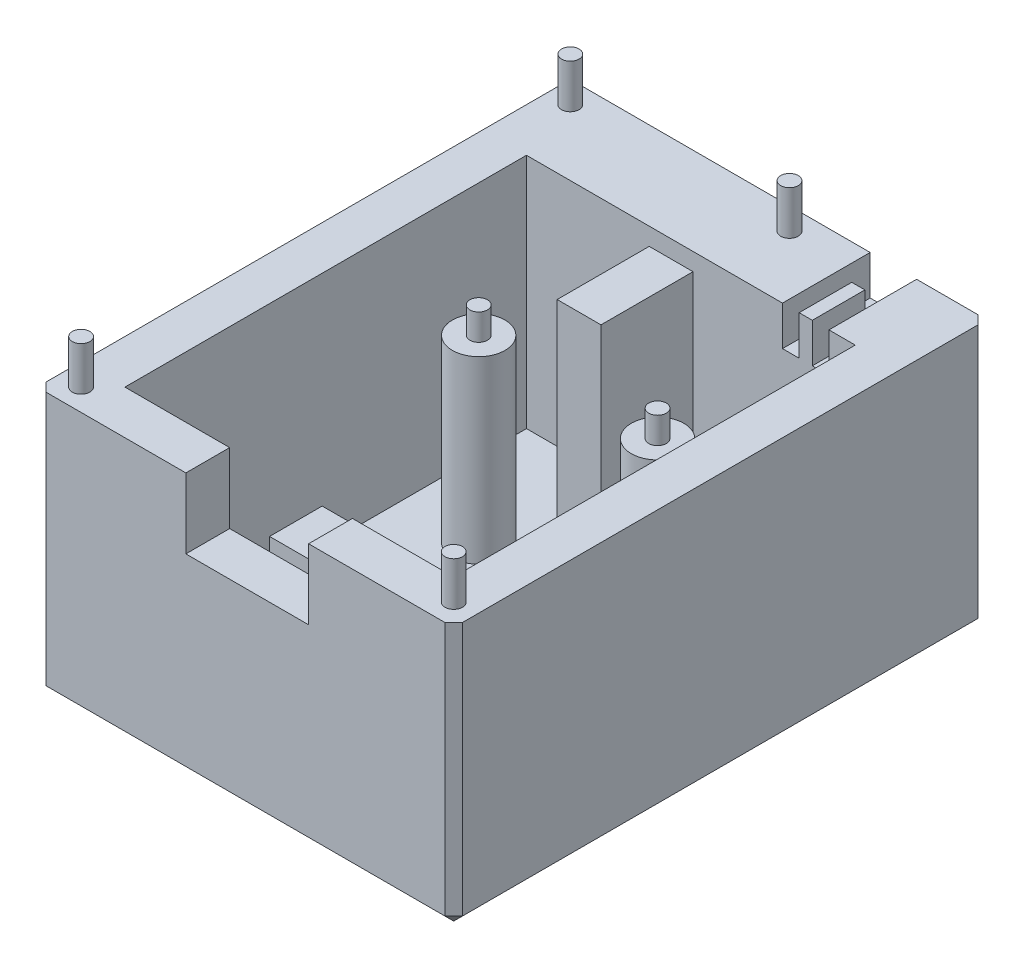
from build123d import *

# Parameters (mm, degrees)
SKETCH_1_W          = 47.5
SKETCH_1_H          = 60.8
EXTRUDE_1_DEPTH     = 30
SKETCH_2_R          = 1
EXTRUDE_3_DEPTH     = 5
SKETCH_3_W          = 37.5
SKETCH_3_H          = 45.8
CUT_EXTRUDE_1_DEPTH = 27
SKETCH_4_W          = 14
SKETCH_4_H          = 5
CUT_EXTRUDE_2_DEPTH = 8
SKETCH_5_R          = 3
SKETCH_5_W          = 6
SKETCH_5_H          = 6
EXTRUDE_4_DEPTH     = 20.5
SKETCH_6_W          = 5
SKETCH_6_H          = 10.5
EXTRUDE_6_DEPTH     = 25
SKETCH_7_R          = 1
EXTRUDE_7_DEPTH     = 3
SKETCH_12_W         = 5.3
SKETCH_12_H         = 4.5
CUT_EXTRUDE_5_DEPTH = 10
SKETCH_13_W         = 1.5
SKETCH_13_H         = 6
EXTRUDE_8_DEPTH     = 4.5
SKETCH_14_W         = 30
SKETCH_14_H         = 3
CUT_EXTRUDE_6_DEPTH = 3
CHAMFER_1_SIZE      = 1


with BuildPart() as part:
    # 草图1 → 凸台-拉伸1 (new body)
    with BuildSketch(Plane(origin=(0, 0, 0), x_dir=(1, 0, 0), z_dir=(0, 1, 0))):
        with Locations((-26.283333333, -1.583333333)):
            Rectangle(SKETCH_1_W, SKETCH_1_H)
    extrude(amount=EXTRUDE_1_DEPTH)

    # 草图2 → 凸台-拉伸3 (add)
    with BuildSketch(Plane(origin=(0, 30, 0), x_dir=(1, 0, 0), z_dir=(0, 1, 0))):
        with Locations((-22.533333333, 26.316666667)):
            Circle(SKETCH_2_R)
        with Locations((-47.533333333, 26.316666667)):
            Circle(SKETCH_2_R)
        with Locations((-47.533333333, -29.483333333)):
            Circle(SKETCH_2_R)
        with Locations((-5.033333333, -29.483333333)):
            Circle(SKETCH_2_R)
    extrude(amount=EXTRUDE_3_DEPTH)

    # 草图3 → 切除-拉伸1 (cut)
    with BuildSketch(Plane(origin=(0, 30, 0), x_dir=(1, 0, 0), z_dir=(0, 1, 0))):
        with Locations((-26.283333333, -4.083333333)):
            Rectangle(SKETCH_3_W, SKETCH_3_H)
    extrude(amount=-CUT_EXTRUDE_1_DEPTH, mode=Mode.SUBTRACT)

    # 草图4 → 切除-拉伸2 (cut)
    with BuildSketch(Plane(origin=(0, 30, 0), x_dir=(1, 0, 0), z_dir=(0, 1, 0))):
        with Locations((-26.083333333, -29.483333333)):
            Rectangle(SKETCH_4_W, SKETCH_4_H)
    extrude(amount=-CUT_EXTRUDE_2_DEPTH, mode=Mode.SUBTRACT)

    # 草图5 → 凸台-拉伸4 (add)
    with BuildSketch(Plane(origin=(0, 3, 0), x_dir=(1, 0, 0), z_dir=(0, 1, 0))):
        with Locations((-16.083333333, 4.816666667)):
            Circle(SKETCH_5_R)
        with Locations((-36.483333333, 4.816666667)):
            Circle(SKETCH_5_R)
        with Locations((-25.533333333, -23.983333333)):
            Rectangle(SKETCH_5_W, SKETCH_5_H)
    extrude(amount=EXTRUDE_4_DEPTH)

    # 草图6 → 凸台-拉伸6 (add)
    with BuildSketch(Plane(origin=(0, 3, 0), x_dir=(1, 0, 0), z_dir=(0, 1, 0))):
        with Locations((-28.533333333, 13.566666667)):
            Rectangle(SKETCH_6_W, SKETCH_6_H)
    extrude(amount=EXTRUDE_6_DEPTH)

    # 草图7 → 凸台-拉伸7 (add)
    with BuildSketch(Plane(origin=(0, 23.5, 0), x_dir=(1, 0, 0), z_dir=(0, 1, 0))):
        with Locations((-36.483333333, 4.816666667)):
            Circle(SKETCH_7_R)
        with Locations((-16.083333333, 4.816666667)):
            Circle(SKETCH_7_R)
    extrude(amount=EXTRUDE_7_DEPTH)

    # 草图12 → 切除-拉伸5 (cut)
    with BuildSketch(Plane(origin=(0, 0, -28.816666667), x_dir=(-1, 0, 0), z_dir=(0, 0, -1))):
        with Locations((13.183333333, 27.75)):
            Rectangle(SKETCH_12_W, SKETCH_12_H)
    extrude(amount=-CUT_EXTRUDE_5_DEPTH, mode=Mode.SUBTRACT)

    # 草图13 → 凸台-拉伸8 (add)
    with BuildSketch(Plane(origin=(0, 25.5, 0), x_dir=(1, 0, 0), z_dir=(0, 1, 0))):
        with Locations((-13.183333333, 21.816666667)):
            Rectangle(SKETCH_13_W, SKETCH_13_H)
    extrude(amount=EXTRUDE_8_DEPTH)

    # 草图14 → 切除-拉伸6 (cut)
    with BuildSketch(Plane(origin=(0, 3, 0), x_dir=(1, 0, 0), z_dir=(0, 1, 0))):
        with Locations((-26.033333333, -2.090371048)):
            Rectangle(SKETCH_14_W, SKETCH_14_H)
        with Locations((-26.033333333, -8.090371048)):
            Rectangle(SKETCH_14_W, SKETCH_14_H)
        with Locations((-26.033333333, -14.090371048)):
            Rectangle(SKETCH_14_W, SKETCH_14_H)
    extrude(amount=-CUT_EXTRUDE_6_DEPTH, mode=Mode.SUBTRACT)

    # 倒角1
    chamfer_1_edges = [part.edges().sort_by_distance(p)[0] for p in [
        (-2.533333333, 15, 31.983333333),
        (-26.283333333, 0, 31.983333333),
        (-50.033333333, 15, 31.983333333),
        (-50.033333333, 0, 1.583333333),
        (-50.033333333, 15, -28.816666667),
        (-2.533333333, 0, 1.583333333),
        (-26.283333333, 0, -28.816666667),
        (-2.533333333, 15, -28.816666667),
    ]]
    chamfer(chamfer_1_edges, length=CHAMFER_1_SIZE)


solid = part.part
